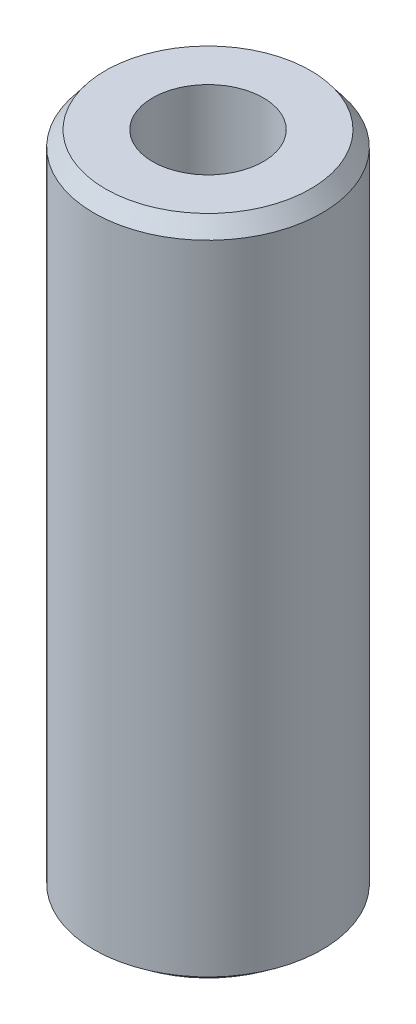
from build123d import *
from OCP.BRepFilletAPI import BRepFilletAPI_MakeChamfer

# Parameters (mm, degrees)
SKETCH1_R           = 10
BOSS_EXTRUDE1_DEPTH = 58.244262374
SKETCH2_R           = 4.850319766
CUT_EXTRUDE1_DEPTH  = 60.936583983
CHAMFER1_SIZE       = 1.321894537
CHAMFER1_SIZE2      = 1.01318083


with BuildPart() as part:
    # Sketch1 → Boss-Extrude1 (new body)
    with BuildSketch(Plane(origin=(0, 0, 0), x_dir=(1, 0, 0), z_dir=(0, 1, 0))):
        Circle(SKETCH1_R)
    extrude(amount=BOSS_EXTRUDE1_DEPTH)

    # Sketch2 → Cut-Extrude1 (cut, through all)
    with BuildSketch(Plane(origin=(0, 0, 0), x_dir=(1, 0, 0), z_dir=(0, 1, 0))):
        Circle(SKETCH2_R)
    extrude(amount=CUT_EXTRUDE1_DEPTH, mode=Mode.SUBTRACT)

    # Chamfer1: one chamfer whose edges measure the first distance from different faces: ONE call of the kernel's chamfer builder (chamfer() names one face for all edges)
    chamfer1_edges_1 = [part.edges().sort_by_distance(p)[0] for p in [
        (-10, 58.244262374, 0),
    ]]
    chamfer1_side_1 = [part.faces().sort_by_distance(p)[0] for p in [
        (-10, 29.122131187, 0),
    ]]
    chamfer1_edges_2 = [part.edges().sort_by_distance(p)[0] for p in [
        (-10, 0, 0),
    ]]
    chamfer1_side_2 = [part.faces().sort_by_distance(p)[0] for p in [
        (-9.717157288, 0, 0),
    ]]
    chamfer1 = BRepFilletAPI_MakeChamfer(part.part.solid().wrapped)
    for e in chamfer1_edges_1:
        chamfer1.Add(CHAMFER1_SIZE, CHAMFER1_SIZE2, e.wrapped, chamfer1_side_1[0].wrapped)  # the first distance lies on this face
    for e in chamfer1_edges_2:
        chamfer1.Add(CHAMFER1_SIZE, CHAMFER1_SIZE2, e.wrapped, chamfer1_side_2[0].wrapped)  # the first distance lies on this face
    add(Compound.cast(chamfer1.Shape()), mode=Mode.REPLACE)


solid = part.part
